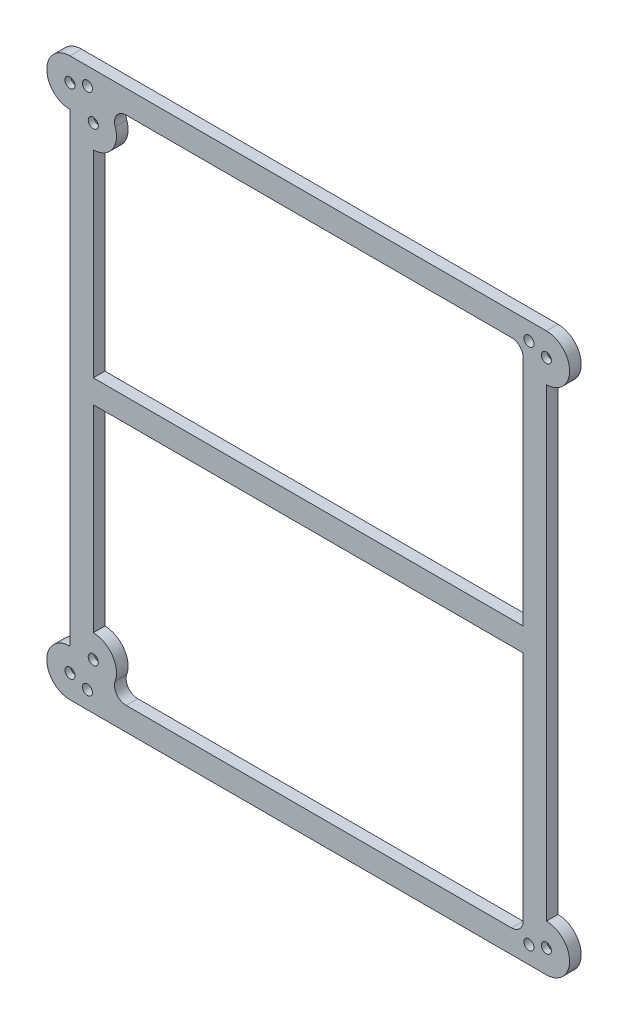
from build123d import *

# Parameters (mm, degrees)
SKETCH1_R           = 2.75
BOSS_EXTRUDE1_DEPTH = 6.35
FILLET1_R           = 6.35
CHAMFER1_SIZE       = 3.175
SKETCH2_W           = 234.95
SKETCH2_H           = 12.7
BOSS_EXTRUDE2_DEPTH = 6.35


with BuildPart() as part:
    # Sketch1 → Boss-Extrude1 (new body)
    with BuildSketch(Plane.XY):
        with BuildLine():
            ThreePointArc((-19.05, 19.05), (-31.75, 6.35), (-19.05, -6.35))
            Line((-19.05, -6.35), (-19.05, -260.35))
            ThreePointArc((-19.05, -260.35), (-31.75, -273.05), (-19.05, -285.75))
            Line((-19.05, -285.75), (241.3, -285.75))
            ThreePointArc((241.3, -285.75), (254, -273.05), (241.3, -260.35))
            Line((241.3, -260.35), (241.3, -6.35))
            ThreePointArc((241.3, -6.35), (254, 6.35), (241.3, 19.05))
            Line((241.3, 19.05), (-19.05, 19.05))
        make_face()
        with Locations((241.3, 6.35)):
            Circle(SKETCH1_R, mode=Mode.SUBTRACT)
        with Locations((-19.05, -273.05)):
            Circle(SKETCH1_R, mode=Mode.SUBTRACT)
        with Locations((-9.525, -276.225)):
            Circle(SKETCH1_R, mode=Mode.SUBTRACT)
        with Locations((231.775, -276.225)):
            Circle(SKETCH1_R, mode=Mode.SUBTRACT)
        with Locations((241.3, -273.05)):
            Circle(SKETCH1_R, mode=Mode.SUBTRACT)
        with BuildLine():
            Line((-6.35, -247.65), (-6.35, -19.05))
            ThreePointArc((-6.35, -19.05), (6.35, -6.35), (-6.35, 6.35))
            Line((-6.35, 6.35), (228.6, 6.35))
            Line((228.6, 6.35), (228.6, -273.05))
            Line((228.6, -273.05), (-6.35, -273.05))
            ThreePointArc((-6.35, -273.05), (6.35, -260.35), (-6.35, -247.65))
        make_face(mode=Mode.SUBTRACT)
        with Locations((-6.35, -6.35)):
            Circle(SKETCH1_R, mode=Mode.SUBTRACT)
        with Locations((-6.35, -260.35)):
            Circle(SKETCH1_R, mode=Mode.SUBTRACT)
        with Locations((-19.05, 6.35)):
            Circle(SKETCH1_R, mode=Mode.SUBTRACT)
        with Locations((-9.525, 9.525)):
            Circle(SKETCH1_R, mode=Mode.SUBTRACT)
        with Locations((231.775, 9.525)):
            Circle(SKETCH1_R, mode=Mode.SUBTRACT)
    extrude(amount=BOSS_EXTRUDE1_DEPTH)

    # Fillet1
    fillet1_edges = [part.edges().sort_by_distance(p)[0] for p in [
        (228.6, -273.05, 3.175),
        (228.6, 6.35, 3.175),
        (-6.35, 6.35, 3.175),
    ]]
    fillet(fillet1_edges, radius=FILLET1_R)
    fillet1_2_edges = [part.edges().sort_by_distance(p)[0] for p in [
        (-6.35, -273.05, 3.175),
    ]]
    fillet(fillet1_2_edges, radius=FILLET1_R)

    # Chamfer1
    chamfer1_edges = [part.edges().sort_by_distance(p)[0] for p in [
        (-21.8, 6.35, 0),
        (-21.8, -273.05, 0),
        (238.55, 6.35, 0),
        (238.55, -273.05, 0),
        (-9.1, -260.35, 0),
        (-9.1, -6.35, 0),
    ]]
    chamfer(chamfer1_edges, length=CHAMFER1_SIZE)

    # Sketch2 → Boss-Extrude2 (add)
    with BuildSketch(Plane.XY.offset(6.35)):
        with Locations((111.125, -133.35)):
            Rectangle(SKETCH2_W, SKETCH2_H)
    extrude(amount=-BOSS_EXTRUDE2_DEPTH)


solid = part.part
